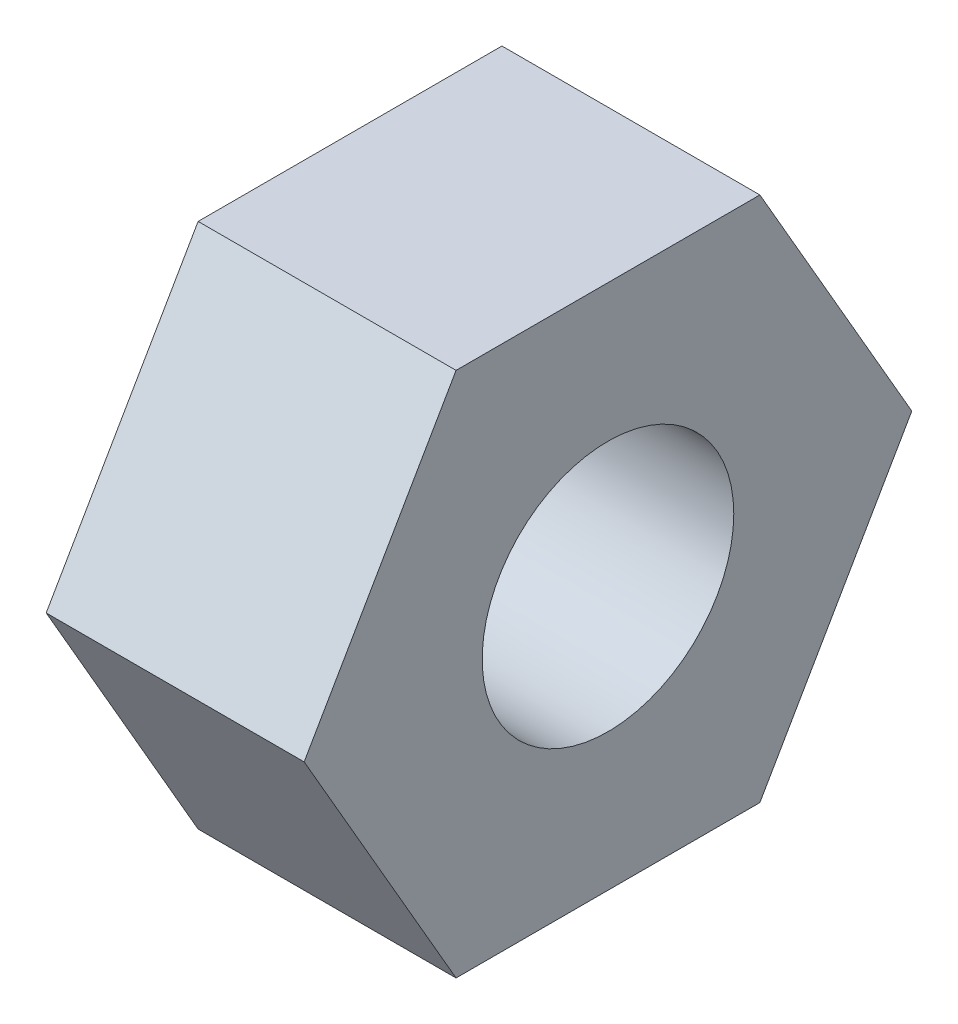
from build123d import *

# Parameters (mm, degrees)
BOSS_EXTRUDE1_DEPTH   = 2.5
F_2_CLEARANCE_HOLE1_D = 2.4384


with BuildPart() as part:
    # Sketch1 → Boss-Extrude1 (new body)
    with BuildSketch(Plane(origin=(0, 0, 0), x_dir=(0, 0, -1), z_dir=(1, 0, 0))):
        Polygon((2.944486373, 0), (1.472243186, 2.55), (-1.472243186, 2.55), (-2.944486373, 0), (-1.472243186, -2.55), (1.472243186, -2.55), align=None)
    extrude(amount=BOSS_EXTRUDE1_DEPTH)

    # #2 Clearance Hole1 (through all)
    with Locations(Plane(origin=(2.5, 0, 0), x_dir=(0, 0, -1), z_dir=(1, 0, 0))):
        with Locations((0, 0)):
            Hole(F_2_CLEARANCE_HOLE1_D / 2)


solid = part.part
